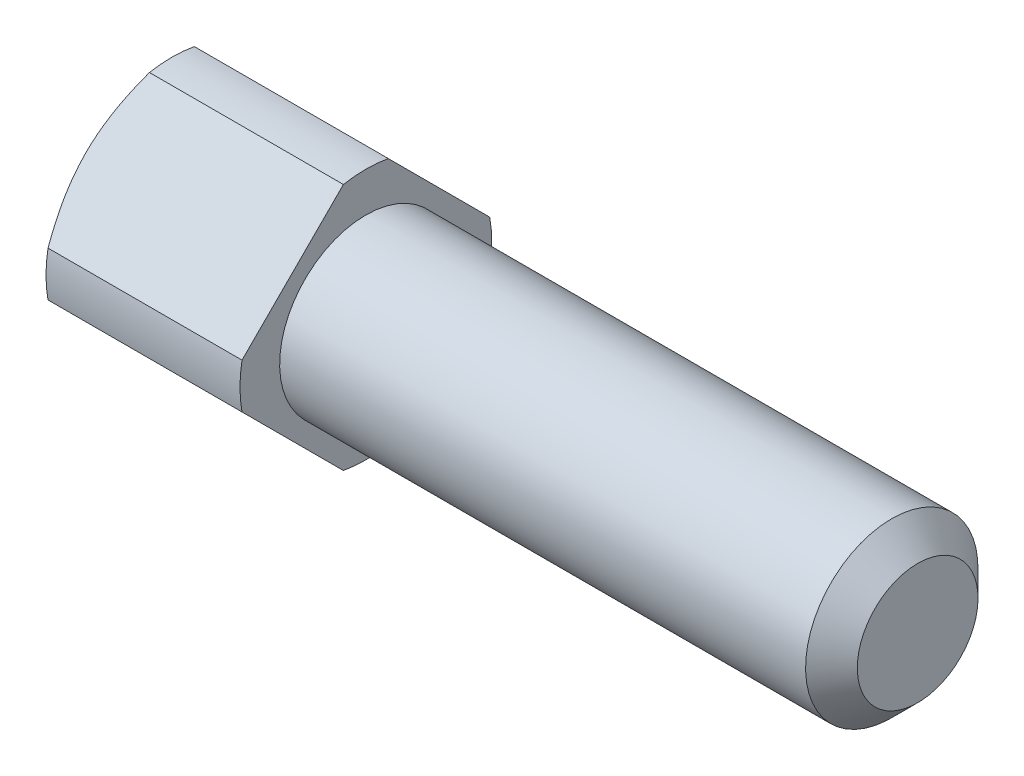
from build123d import *

# Parameters (mm, degrees)
SKETCH1_R          = 3.65
BASEHEAD_DEPTH     = 6
SKETCH2_OUTSIDE_W  = 11.688
SKETCH2_OUTSIDE_H  = 11.688
CUT_EXTRUDE1_DEPTH = 6


with BuildPart() as part:
    # Sketch1 → BaseHead (new body)
    with BuildSketch(Plane(origin=(0, 0, 0), x_dir=(0, 0, -1), z_dir=(1, 0, 0))):
        Circle(SKETCH1_R)
    extrude(amount=BASEHEAD_DEPTH)

    # Sketch2 outside → Cut-Extrude1 (cut)
    with BuildSketch(Plane(origin=(0, 1.683051278, -0.120507627), x_dir=(0, 0, 1), z_dir=(-1, 0, 0))):
        with Locations((0.121, -1.683)):
            Rectangle(SKETCH2_OUTSIDE_W, SKETCH2_OUTSIDE_H)
        Polygon((4.363148314, -1.683051278), (0.120507627, 2.559589409), (-4.12213306, -1.683051278), (0.120507627, -5.925691965), align=None, mode=Mode.SUBTRACT)
    extrude(amount=-CUT_EXTRUDE1_DEPTH, mode=Mode.SUBTRACT)

    # Sketch3 → Cut-Revolve1 (revolve, cut)
    with BuildSketch(Plane(origin=(1.259716749, -5.274716749, 0), x_dir=(0, -1, 0), z_dir=(0, 0, 1))):
        Polygon((-9.289716749, -1.259716749), (-8.274716749, -1.259716749), (-9.289716749, -0.673706226), align=None)
    revolve(axis=Axis((1.545283251, 0, 0), (-1, 0, 0)), mode=Mode.SUBTRACT)

    # Sketch4 → BaseBody (revolve)
    with BuildSketch(Plane(origin=(-10.34721472, 12.84721472, 0), x_dir=(0, -1, 0), z_dir=(0, 0, 1))):
        Polygon((12.84721472, 16.34721472), (15.34721472, 16.34721472), (15.34721472, 31.59721472), (14.59721472, 32.34721472), (12.84721472, 32.34721472), align=None)
    revolve(axis=Axis((14.086803097, 0, 0), (-1, 0, 0)))


solid = part.part
